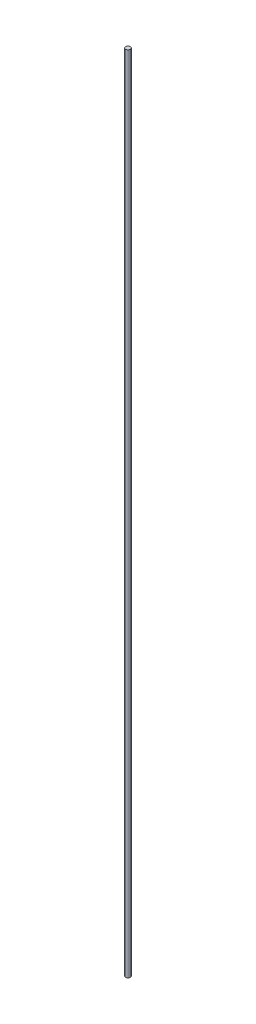
from build123d import *

# Parameters (mm, degrees)
SKETCH_2_W = 2.5
SKETCH_2_H = 859.06


with BuildPart() as part:
    # Эскиз2 → Повернуть1 (revolve)
    with BuildSketch(Plane.XY):
        with Locations((-1.25, -81.829999997)):
            Rectangle(SKETCH_2_W, SKETCH_2_H)
    revolve(axis=Axis((-2.5, 347.700000003, 0), (0, -1, 0)))


solid = part.part
